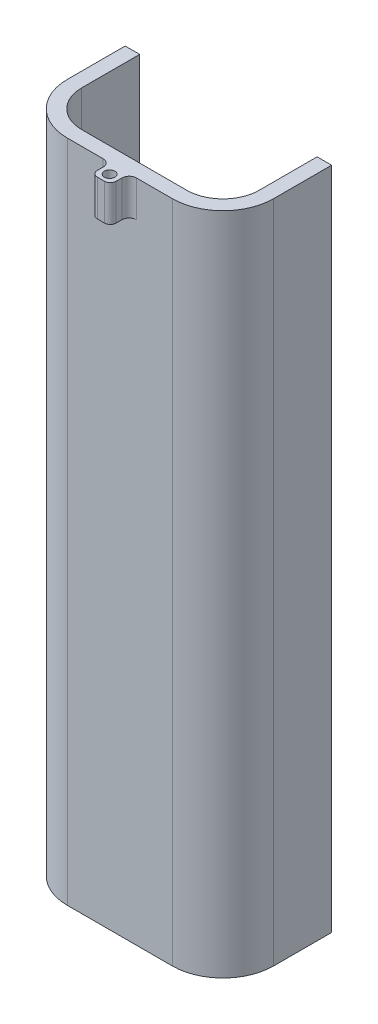
from build123d import *
from build123d.topology import SkipClean

# Parameters (mm, degrees)
SKETCH1_W           = 57
SKETCH1_H           = 183.5
SKETCH1_W_2         = 49
SKETCH1_H_2         = 175.5
BOSS_EXTRUDE1_DEPTH = 30
BOSS_EXTRUDE2_DEPTH = 175.5
FILLET1_R           = 14
CUT_EXTRUDE1_DEPTH  = 179.5
SKETCH6_R           = 1.6
SKETCH6_R_2         = 1.45
BOSS_EXTRUDE5_DEPTH = 10


with BuildPart() as part:
    # Sketch1 → Boss-Extrude1 (new body)
    with BuildSketch(Plane.XY):
        with Locations((0, 18.25)):
            Rectangle(SKETCH1_W, SKETCH1_H)
        with Locations((0, 18.25)):
            Rectangle(SKETCH1_W_2, SKETCH1_H_2, mode=Mode.SUBTRACT)
    extrude(amount=BOSS_EXTRUDE1_DEPTH)

    # Sketch2 → Boss-Extrude2 (add)
    with BuildSketch(Plane(origin=(0, -69.5, 0), x_dir=(1, 0, 0), z_dir=(0, 1, 0))):
        with BuildLine():
            Line((14.5, -26), (24.5, -26))
            Line((24.5, -26), (24.5, -16))
            ThreePointArc((24.5, -16), (21.571067812, -23.071067812), (14.5, -26))
        make_face()
        Polygon((-24.5, -30), (24.5, -30), (24.5, -26), (14.5, -26), (-14.5, -26), (-24.5, -26), align=None)
        with BuildLine():
            Line((-24.5, -16), (-24.5, -26))
            Line((-24.5, -26), (-14.5, -26))
            ThreePointArc((-14.5, -26), (-21.571067812, -23.071067812), (-24.5, -16))
        make_face()
    extrude(amount=BOSS_EXTRUDE2_DEPTH)

    # Fillet1
    fillet1_edges = [part.edges().sort_by_distance(p)[0] for p in [
        (-28.5, 18.25, 30),
        (28.5, 18.25, 30),
    ]]
    fillet(fillet1_edges, radius=FILLET1_R)

    # Sketch2<4> → Cut-Extrude1 (cut)
    with SkipClean():  # the faces are left unmerged after this step: merging them gives an invalid solid
        with BuildSketch(Plane(origin=(0, -69.5, 0), x_dir=(1, 0, 0), z_dir=(0, 1, 0))):
            with BuildLine():
                Line((-14.5, -26), (14.5, -26))
                ThreePointArc((14.5, -26), (21.571067812, -23.071067812), (24.5, -16))
                Line((24.5, -16), (24.5, 0))
                Line((24.5, 0), (-24.5, 0))
                Line((-24.5, 0), (-24.5, -16))
                ThreePointArc((-24.5, -16), (-21.571067812, -23.071067812), (-14.5, -26))
            make_face()
        extrude(amount=CUT_EXTRUDE1_DEPTH, mode=Mode.SUBTRACT)
    add(part.part.scale(1), mode=Mode.REPLACE)  # the faces are merged on a copy

    # Sketch6 → Boss-Extrude5 (add)
    # profile 1 of 2: a face of its own
    with BuildSketch(Plane(origin=(0, 110, 0), x_dir=(1, 0, 0), z_dir=(0, 1, 0))):
        with BuildLine():
            ThreePointArc((1, -35.2), (2.13137085, -34.73137085), (2.6, -33.6))
            Line((2.6, -33.6), (2.6, -32))
            ThreePointArc((2.6, -32), (3.185786438, -30.585786438), (4.6, -30))
            Line((4.6, -30), (-4.6, -30))
            ThreePointArc((-4.6, -30), (-3.185786438, -30.585786438), (-2.6, -32))
            Line((-2.6, -32), (-2.6, -33.6))
            ThreePointArc((-2.6, -33.6), (-2.13137085, -34.73137085), (-1, -35.2))
            Line((-1, -35.2), (1, -35.2))
        make_face()
        with Locations((0, -32.8)):
            Circle(SKETCH6_R, mode=Mode.SUBTRACT)
    # profile 2 of 2: a face of its own
    with BuildSketch(Plane(origin=(0, 110, 0), x_dir=(1, 0, 0), z_dir=(0, 1, 0))):
        with Locations((0, -32.8)):
            Circle(SKETCH6_R)
        with Locations(Location((0, -32.8, 0), (0, 0, 270))):
            Circle(SKETCH6_R_2, mode=Mode.SUBTRACT)
    extrude(amount=-BOSS_EXTRUDE5_DEPTH)


solid = part.part
